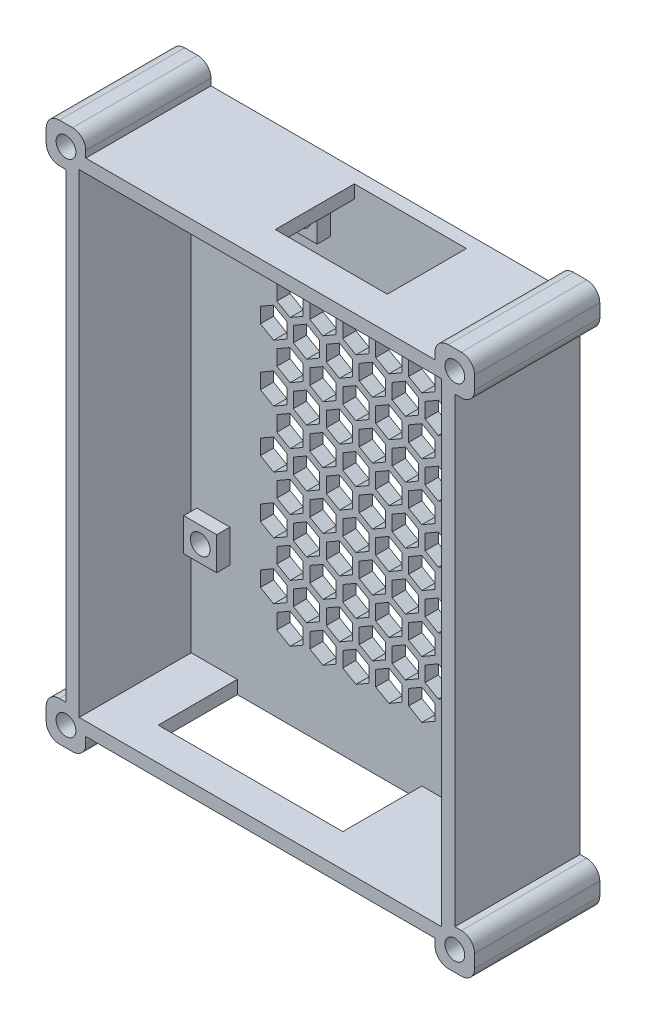
from build123d import *

# Parameters (mm, degrees)
BOSS_EXTRUDE1_START      = 1
SKETCH1_W                = 55
SKETCH1_H                = 72
BOSS_EXTRUDE1_DEPTH      = 2
BOSS_EXTRUDE2_DEPTH      = 17
BOSS_EXTRUDE2_DEPTH_BACK = 2
SKETCH2_W                = 59
SKETCH2_H                = 76
SKETCH2_W_2              = 55
SKETCH2_H_2              = 72
SKETCH5_R                = 1.5
BOSS_EXTRUDE3_DEPTH      = 2
CUT_EXTRUDE3_START       = -2
SKETCH6_R                = 1.5
CUT_EXTRUDE3_DEPTH       = 2
CUT_EXTRUDE4_DEPTH       = 2
BOSS_EXTRUDE4_DEPTH      = 19
FILLET1_R                = 2
SKETCH12_R               = 1.5
CUT_EXTRUDE5_DEPTH       = 19
CUT_EXTRUDE6_DEPTH       = 2
CUT_EXTRUDE7_DEPTH       = 2


with BuildPart() as part:
    # Sketch1 → Boss-Extrude1 (new body)
    with BuildSketch(Plane.XY.offset(BOSS_EXTRUDE1_START)):
        Rectangle(SKETCH1_W, SKETCH1_H)
    extrude(amount=BOSS_EXTRUDE1_DEPTH)

    # Sketch2 → Boss-Extrude2 (add, two sides: drawn at the far end of the back side and taken through both)
    with BuildSketch(Plane.XY.offset(3).offset(-BOSS_EXTRUDE2_DEPTH_BACK)):
        Rectangle(SKETCH2_W, SKETCH2_H)
        Rectangle(SKETCH2_W_2, SKETCH2_H_2, mode=Mode.SUBTRACT)
    extrude(amount=BOSS_EXTRUDE2_DEPTH + BOSS_EXTRUDE2_DEPTH_BACK)

    # Sketch5 → Boss-Extrude3 (add)
    # profile 1 of 4: a face of its own
    with BuildSketch(Plane(origin=(0, 0, 3), x_dir=(-1, 0, 0), z_dir=(0, 0, 1))):
        Polygon((-24.13, 22.82), (-21.63, 22.82), (-21.63, 17.82), (-26.63, 17.82), (-26.63, 22.82), align=None)
        with Locations(Location((-24.13, 20.32, 0), (0, 0, 180))):
            Circle(SKETCH5_R, mode=Mode.SUBTRACT)
    # profile 2 of 4: a face of its own
    with BuildSketch(Plane(origin=(0, 0, 3), x_dir=(-1, 0, 0), z_dir=(0, 0, 1))):
        Polygon((24.13, 21.55), (21.63, 21.55), (21.63, 16.55), (26.63, 16.55), (26.63, 21.55), align=None)
        with Locations(Location((24.13, 19.05, 0), (0, 0, 180))):
            Circle(SKETCH5_R, mode=Mode.SUBTRACT)
    # profile 3 of 4: a face of its own
    with BuildSketch(Plane(origin=(0, 0, 3), x_dir=(-1, 0, 0), z_dir=(0, 0, 1))):
        Polygon((-19.05, -29.25), (-16.55, -29.25), (-16.55, -34.25), (-21.55, -34.25), (-21.55, -29.25), align=None)
        with Locations(Location((-19.05, -31.75, 0), (0, 0, 180))):
            Circle(SKETCH5_R, mode=Mode.SUBTRACT)
    # profile 4 of 4: a face of its own
    with BuildSketch(Plane(origin=(0, 0, 3), x_dir=(-1, 0, 0), z_dir=(0, 0, 1))):
        Polygon((8.89, -29.25), (11.39, -29.25), (11.39, -34.25), (6.39, -34.25), (6.39, -29.25), align=None)
        with Locations(Location((8.89, -31.75, 0), (0, 0, 180))):
            Circle(SKETCH5_R, mode=Mode.SUBTRACT)
    extrude(amount=BOSS_EXTRUDE3_DEPTH)

    # Sketch6 → Cut-Extrude3 (cut)
    with BuildSketch(Plane.XY.offset(3).offset(CUT_EXTRUDE3_START)):
        with Locations((19.05, 31.75)):
            Circle(SKETCH6_R)
        with Locations((-8.89, 31.75)):
            Circle(SKETCH6_R)
        with Locations((-24.13, -19.05)):
            Circle(SKETCH6_R)
        with Locations((24.13, -20.32)):
            Circle(SKETCH6_R)
    extrude(amount=CUT_EXTRUDE3_DEPTH, mode=Mode.SUBTRACT)

    # Sketch8 → Cut-Extrude4 (cut)
    with BuildSketch(Plane.XY.offset(3)):
        Polygon((-7.5, 20.269505142), (-9.5, 19.114804604), (-9.5, 16.805403527), (-7.5, 15.650702989), (-5.5, 16.805403527), (-5.5, 19.114804604), align=None)
        Polygon((-10, 24.599632161), (-12, 23.444931623), (-12, 21.135530546), (-10, 19.980830008), (-8, 21.135530546), (-8, 23.444931623), align=None)
        Polygon((-2.5, 20.269505142), (-4.5, 19.114804604), (-4.5, 16.805403527), (-2.5, 15.650702989), (-0.5, 16.805403527), (-0.5, 19.114804604), align=None)
        Polygon((-5, 24.599632161), (-7, 23.444931623), (-7, 21.135530546), (-5, 19.980830008), (-3, 21.135530546), (-3, 23.444931623), align=None)
        Polygon((2.5, 20.269505142), (0.5, 19.114804604), (0.5, 16.805403527), (2.5, 15.650702989), (4.5, 16.805403527), (4.5, 19.114804604), align=None)
        Polygon((0, 24.599632161), (-2, 23.444931623), (-2, 21.135530546), (0, 19.980830008), (2, 21.135530546), (2, 23.444931623), align=None)
        Polygon((7.5, 20.269505142), (5.5, 19.114804604), (5.5, 16.805403527), (7.5, 15.650702989), (9.5, 16.805403527), (9.5, 19.114804604), align=None)
        Polygon((5, 24.599632161), (3, 23.444931623), (3, 21.135530546), (5, 19.980830008), (7, 21.135530546), (7, 23.444931623), align=None)
        Polygon((12.5, 20.269505142), (10.5, 19.114804604), (10.5, 16.805403527), (12.5, 15.650702989), (14.5, 16.805403527), (14.5, 19.114804604), align=None)
        Polygon((10, 24.599632161), (8, 23.444931623), (8, 21.135530546), (10, 19.980830008), (12, 21.135530546), (12, 23.444931623), align=None)
        Polygon((-7.5, 11.609505142), (-9.5, 10.454804604), (-9.5, 8.145403527), (-7.5, 6.990702989), (-5.5, 8.145403527), (-5.5, 10.454804604), align=None)
        Polygon((-10, 15.939632161), (-12, 14.784931623), (-12, 12.475530546), (-10, 11.320830008), (-8, 12.475530546), (-8, 14.784931623), align=None)
        Polygon((-2.5, 11.609505142), (-4.5, 10.454804604), (-4.5, 8.145403527), (-2.5, 6.990702989), (-0.5, 8.145403527), (-0.5, 10.454804604), align=None)
        Polygon((-5, 15.939632161), (-7, 14.784931623), (-7, 12.475530546), (-5, 11.320830008), (-3, 12.475530546), (-3, 14.784931623), align=None)
        Polygon((2.5, 11.609505142), (0.5, 10.454804604), (0.5, 8.145403527), (2.5, 6.990702989), (4.5, 8.145403527), (4.5, 10.454804604), align=None)
        Polygon((0, 15.939632161), (-2, 14.784931623), (-2, 12.475530546), (0, 11.320830008), (2, 12.475530546), (2, 14.784931623), align=None)
        Polygon((7.5, 11.609505142), (5.5, 10.454804604), (5.5, 8.145403527), (7.5, 6.990702989), (9.5, 8.145403527), (9.5, 10.454804604), align=None)
        Polygon((5, 15.939632161), (3, 14.784931623), (3, 12.475530546), (5, 11.320830008), (7, 12.475530546), (7, 14.784931623), align=None)
        Polygon((12.5, 11.609505142), (10.5, 10.454804604), (10.5, 8.145403527), (12.5, 6.990702989), (14.5, 8.145403527), (14.5, 10.454804604), align=None)
        Polygon((10, 15.939632161), (8, 14.784931623), (8, 12.475530546), (10, 11.320830008), (12, 12.475530546), (12, 14.784931623), align=None)
        Polygon((-7.5, 2.949505142), (-9.5, 1.794804604), (-9.5, -0.514596473), (-7.5, -1.669297011), (-5.5, -0.514596473), (-5.5, 1.794804604), align=None)
        Polygon((-10, 7.279632161), (-12, 6.124931623), (-12, 3.815530546), (-10, 2.660830008), (-8, 3.815530546), (-8, 6.124931623), align=None)
        Polygon((-2.5, 2.949505142), (-4.5, 1.794804604), (-4.5, -0.514596473), (-2.5, -1.669297011), (-0.5, -0.514596473), (-0.5, 1.794804604), align=None)
        Polygon((-5, 7.279632161), (-7, 6.124931623), (-7, 3.815530546), (-5, 2.660830008), (-3, 3.815530546), (-3, 6.124931623), align=None)
        Polygon((2.5, 2.949505142), (0.5, 1.794804604), (0.5, -0.514596473), (2.5, -1.669297011), (4.5, -0.514596473), (4.5, 1.794804604), align=None)
        Polygon((0, 7.279632161), (-2, 6.124931623), (-2, 3.815530546), (0, 2.660830008), (2, 3.815530546), (2, 6.124931623), align=None)
        Polygon((7.5, 2.949505142), (5.5, 1.794804604), (5.5, -0.514596473), (7.5, -1.669297011), (9.5, -0.514596473), (9.5, 1.794804604), align=None)
        Polygon((5, 7.279632161), (3, 6.124931623), (3, 3.815530546), (5, 2.660830008), (7, 3.815530546), (7, 6.124931623), align=None)
        Polygon((12.5, 2.949505142), (10.5, 1.794804604), (10.5, -0.514596473), (12.5, -1.669297011), (14.5, -0.514596473), (14.5, 1.794804604), align=None)
        Polygon((10, 7.279632161), (8, 6.124931623), (8, 3.815530546), (10, 2.660830008), (12, 3.815530546), (12, 6.124931623), align=None)
        Polygon((-7.5, -5.710494858), (-9.5, -6.865195396), (-9.5, -9.174596473), (-7.5, -10.329297011), (-5.5, -9.174596473), (-5.5, -6.865195396), align=None)
        Polygon((-10, -1.380367839), (-12, -2.535068377), (-12, -4.844469454), (-10, -5.999169992), (-8, -4.844469454), (-8, -2.535068377), align=None)
        Polygon((-2.5, -5.710494858), (-4.5, -6.865195396), (-4.5, -9.174596473), (-2.5, -10.329297011), (-0.5, -9.174596473), (-0.5, -6.865195396), align=None)
        Polygon((-5, -1.380367839), (-7, -2.535068377), (-7, -4.844469454), (-5, -5.999169992), (-3, -4.844469454), (-3, -2.535068377), align=None)
        Polygon((2.5, -5.710494858), (0.5, -6.865195396), (0.5, -9.174596473), (2.5, -10.329297011), (4.5, -9.174596473), (4.5, -6.865195396), align=None)
        Polygon((0, -1.380367839), (-2, -2.535068377), (-2, -4.844469454), (0, -5.999169992), (2, -4.844469454), (2, -2.535068377), align=None)
        Polygon((7.5, -5.710494858), (5.5, -6.865195396), (5.5, -9.174596473), (7.5, -10.329297011), (9.5, -9.174596473), (9.5, -6.865195396), align=None)
        Polygon((5, -1.380367839), (3, -2.535068377), (3, -4.844469454), (5, -5.999169992), (7, -4.844469454), (7, -2.535068377), align=None)
        Polygon((12.5, -5.710494858), (10.5, -6.865195396), (10.5, -9.174596473), (12.5, -10.329297011), (14.5, -9.174596473), (14.5, -6.865195396), align=None)
        Polygon((10, -1.380367839), (8, -2.535068377), (8, -4.844469454), (10, -5.999169992), (12, -4.844469454), (12, -2.535068377), align=None)
        Polygon((-7.5, -14.370494858), (-9.5, -15.525195396), (-9.5, -17.834596473), (-7.5, -18.989297011), (-5.5, -17.834596473), (-5.5, -15.525195396), align=None)
        Polygon((-10, -10.040367839), (-12, -11.195068377), (-12, -13.504469454), (-10, -14.659169992), (-8, -13.504469454), (-8, -11.195068377), align=None)
        Polygon((-2.5, -14.370494858), (-4.5, -15.525195396), (-4.5, -17.834596473), (-2.5, -18.989297011), (-0.5, -17.834596473), (-0.5, -15.525195396), align=None)
        Polygon((-5, -10.040367839), (-7, -11.195068377), (-7, -13.504469454), (-5, -14.659169992), (-3, -13.504469454), (-3, -11.195068377), align=None)
        Polygon((2.5, -14.370494858), (0.5, -15.525195396), (0.5, -17.834596473), (2.5, -18.989297011), (4.5, -17.834596473), (4.5, -15.525195396), align=None)
        Polygon((0, -10.040367839), (-2, -11.195068377), (-2, -13.504469454), (0, -14.659169992), (2, -13.504469454), (2, -11.195068377), align=None)
        Polygon((7.5, -14.370494858), (5.5, -15.525195396), (5.5, -17.834596473), (7.5, -18.989297011), (9.5, -17.834596473), (9.5, -15.525195396), align=None)
        Polygon((5, -10.040367839), (3, -11.195068377), (3, -13.504469454), (5, -14.659169992), (7, -13.504469454), (7, -11.195068377), align=None)
        Polygon((12.5, -14.370494858), (10.5, -15.525195396), (10.5, -17.834596473), (12.5, -18.989297011), (14.5, -17.834596473), (14.5, -15.525195396), align=None)
        Polygon((10, -10.040367839), (8, -11.195068377), (8, -13.504469454), (10, -14.659169992), (12, -13.504469454), (12, -11.195068377), align=None)
        Polygon((-7.5, -23.030494858), (-9.5, -24.185195396), (-9.5, -26.494596473), (-7.5, -27.649297011), (-5.5, -26.494596473), (-5.5, -24.185195396), align=None)
        Polygon((-10, -18.700367839), (-12, -19.855068377), (-12, -22.164469454), (-10, -23.319169992), (-8, -22.164469454), (-8, -19.855068377), align=None)
        Polygon((-2.5, -23.030494858), (-4.5, -24.185195396), (-4.5, -26.494596473), (-2.5, -27.649297011), (-0.5, -26.494596473), (-0.5, -24.185195396), align=None)
        Polygon((-5, -18.700367839), (-7, -19.855068377), (-7, -22.164469454), (-5, -23.319169992), (-3, -22.164469454), (-3, -19.855068377), align=None)
        Polygon((2.5, -23.030494858), (0.5, -24.185195396), (0.5, -26.494596473), (2.5, -27.649297011), (4.5, -26.494596473), (4.5, -24.185195396), align=None)
        Polygon((0, -18.700367839), (-2, -19.855068377), (-2, -22.164469454), (0, -23.319169992), (2, -22.164469454), (2, -19.855068377), align=None)
        Polygon((7.5, -23.030494858), (5.5, -24.185195396), (5.5, -26.494596473), (7.5, -27.649297011), (9.5, -26.494596473), (9.5, -24.185195396), align=None)
        Polygon((5, -18.700367839), (3, -19.855068377), (3, -22.164469454), (5, -23.319169992), (7, -22.164469454), (7, -19.855068377), align=None)
        Polygon((12.5, -23.030494858), (10.5, -24.185195396), (10.5, -26.494596473), (12.5, -27.649297011), (14.5, -26.494596473), (14.5, -24.185195396), align=None)
        Polygon((10, -18.700367839), (8, -19.855068377), (8, -22.164469454), (10, -23.319169992), (12, -22.164469454), (12, -19.855068377), align=None)
        Polygon((-12.5, 11.609505142), (-14.5, 10.454804604), (-14.5, 8.145403527), (-12.5, 6.990702989), (-10.5, 8.145403527), (-10.5, 10.454804604), align=None)
        Polygon((-15, 15.939632161), (-17, 14.784931623), (-17, 12.475530546), (-15, 11.320830008), (-13, 12.475530546), (-13, 14.784931623), align=None)
        Polygon((-12.5, 2.949505142), (-14.5, 1.794804604), (-14.5, -0.514596473), (-12.5, -1.669297011), (-10.5, -0.514596473), (-10.5, 1.794804604), align=None)
        Polygon((-15, 7.279632161), (-17, 6.124931623), (-17, 3.815530546), (-15, 2.660830008), (-13, 3.815530546), (-13, 6.124931623), align=None)
        Polygon((-12.5, -5.710494858), (-14.5, -6.865195396), (-14.5, -9.174596473), (-12.5, -10.329297011), (-10.5, -9.174596473), (-10.5, -6.865195396), align=None)
        Polygon((-15, -1.380367839), (-17, -2.535068377), (-17, -4.844469454), (-15, -5.999169992), (-13, -4.844469454), (-13, -2.535068377), align=None)
        Polygon((-12.5, -14.370494858), (-14.5, -15.525195396), (-14.5, -17.834596473), (-12.5, -18.989297011), (-10.5, -17.834596473), (-10.5, -15.525195396), align=None)
        Polygon((-15, -10.040367839), (-17, -11.195068377), (-17, -13.504469454), (-15, -14.659169992), (-13, -13.504469454), (-13, -11.195068377), align=None)
        Polygon((-12.5, -23.030494858), (-14.5, -24.185195396), (-14.5, -26.494596473), (-12.5, -27.649297011), (-10.5, -26.494596473), (-10.5, -24.185195396), align=None)
        Polygon((-15, -18.700367839), (-17, -19.855068377), (-17, -22.164469454), (-15, -23.319169992), (-13, -22.164469454), (-13, -19.855068377), align=None)
        Polygon((-15, 24.599632161), (-17, 23.444931623), (-17, 21.135530546), (-15, 19.980830008), (-13, 21.135530546), (-13, 23.444931623), align=None)
        Polygon((-12.5, 20.179062348), (-14.5, 19.02436181), (-14.5, 16.714960733), (-12.5, 15.560260195), (-10.5, 16.714960733), (-10.5, 19.02436181), align=None)
    extrude(amount=-CUT_EXTRUDE4_DEPTH, mode=Mode.SUBTRACT)

    # Sketch11 → Boss-Extrude4 (add)
    with BuildSketch(Plane.XY.offset(20)):
        Polygon((-29.5, 38), (-29.5, 35), (-32.5, 35), (-32.5, 41), (-26.5, 41), (-26.5, 38), align=None)
        Polygon((32.5, 41), (26.5, 41), (26.5, 38), (29.5, 38), (29.5, 35), (32.5, 35), align=None)
        Polygon((29.5, -38), (29.5, -35), (32.5, -35), (32.5, -41), (26.5, -41), (26.5, -38), align=None)
        Polygon((-32.5, -41), (-26.5, -41), (-26.5, -38), (-29.5, -38), (-29.5, -35), (-32.5, -35), align=None)
    extrude(amount=-BOSS_EXTRUDE4_DEPTH)

    # Fillet1
    fillet1_edges = [part.edges().sort_by_distance(p)[0] for p in [
        (-26.5, 41, 10.5),
        (-32.5, 41, 10.5),
        (-32.5, 35, 10.5),
        (26.5, -41, 10.5),
        (32.5, -41, 10.5),
        (32.5, -35, 10.5),
        (26.5, 41, 10.5),
        (32.5, 35, 10.5),
        (32.5, 41, 10.5),
        (-26.5, -41, 10.5),
        (-32.5, -35, 10.5),
        (-32.5, -41, 10.5),
    ]]
    fillet(fillet1_edges, radius=FILLET1_R)

    # Sketch12 → Cut-Extrude5 (cut)
    with BuildSketch(Plane.XY.offset(20)):
        with Locations((-29.5, 38)):
            Circle(SKETCH12_R)
        with Locations(Location((29.5, 38, 0), (0, 0, 180))):
            Circle(SKETCH12_R)
        with Locations((29.5, -38)):
            Circle(SKETCH12_R)
        with Locations(Location((-29.5, -38, 0), (0, 0, 180))):
            Circle(SKETCH12_R)
    extrude(amount=-CUT_EXTRUDE5_DEPTH, mode=Mode.SUBTRACT)

    # Sketch13 → Cut-Extrude6 (cut)
    with BuildSketch(Plane.XZ.offset(38)):
        Polygon((-10.5, 3), (4.5, 3), (7.5, 3), (7.5, 15), (4.5, 15), (-20.5, 15), (-20.5, 3), (-15.5, 3), align=None)
    extrude(amount=-CUT_EXTRUDE6_DEPTH, mode=Mode.SUBTRACT)

    # Sketch14 → Cut-Extrude7 (cut)
    with BuildSketch(Plane(origin=(0, 38, 0), x_dir=(1, 0, 0), z_dir=(0, 1, 0))):
        Polygon((2.2607555, -15), (14.2607555, -15), (14.2607555, -3), (2.2607555, -3), (-2.7392445, -3), (-2.7392445, -15), align=None)
    extrude(amount=-CUT_EXTRUDE7_DEPTH, mode=Mode.SUBTRACT)


solid = part.part
